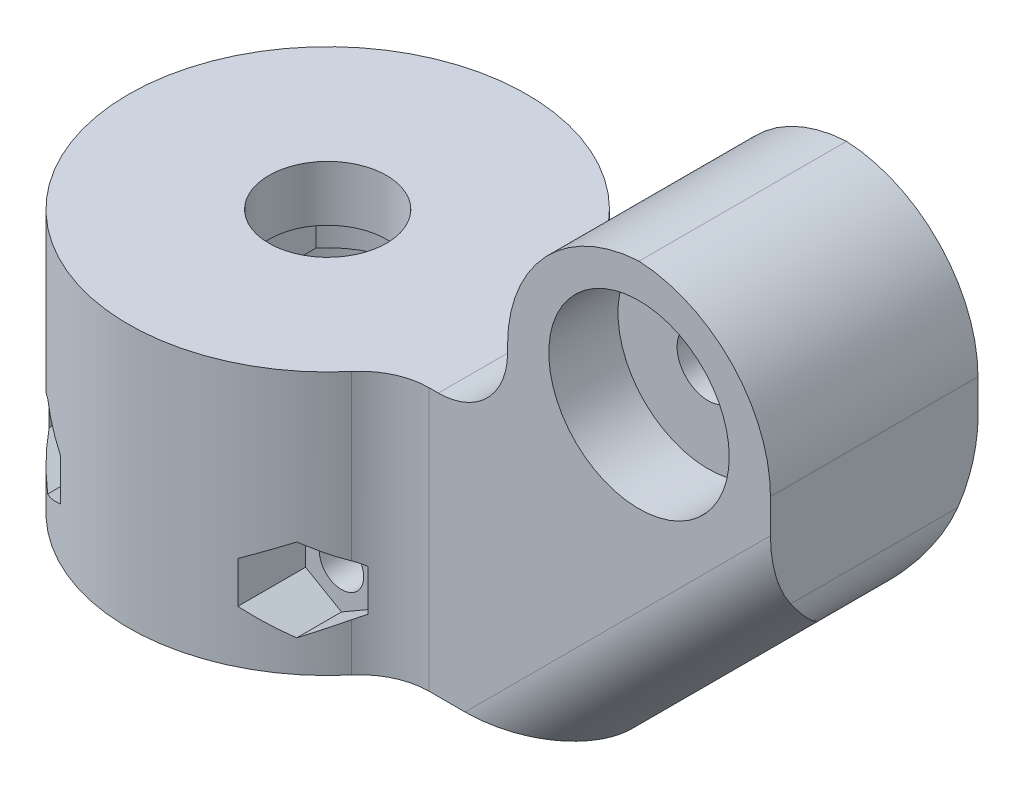
from build123d import *

# Parameters (mm, degrees)
SKETCH1_R               = 2.25
BOSS_EXTRUDE1_DEPTH     = 7.5
CUT_EXTRUDE1_START      = 7.5
SKETCH1_3_R             = 6.52
CUT_EXTRUDE1_DEPTH      = 5
CUT_EXTRUDE2_START      = -7.5
SKETCH1_4_R             = 6.52
CUT_EXTRUDE2_DEPTH      = 5
SKETCH2_R               = 14.4
BOSS_EXTRUDE2_DEPTH     = 19
CUT_EXTRUDE3_DEPTH      = 51.395634732
CUT_EXTRUDE3_DEPTH_BACK = 51.395634732
FILLET1_R               = 5
FILLET2_R               = 10
CUT_EXTRUDE6_DEPTH      = 15
SKETCH5_R               = 8.1
CUT_EXTRUDE7_DEPTH      = 12
CUT_EXTRUDE8_DEPTH      = 54.197654084
CUT_EXTRUDE8_DEPTH_BACK = 54.197654084
SKETCH6_R               = 1.6
CUT_EXTRUDE9_START      = 20
SKETCH6_3_R             = 1.6
CUT_EXTRUDE9_DEPTH      = 12
CUT_EXTRUDE10_START     = -9
SKETCH6_4_R             = 3.5
CUT_EXTRUDE10_DEPTH     = 12
FILLET3_R               = 5


with BuildPart() as part:
    # Sketch1 → Boss-Extrude1 (new, symmetric)
    with BuildSketch(Plane.XY):
        Polygon((-9.5, 9), (9.5, 9), (9.5, -10.52), (-5.5, -25.52), (-30, -25.52), (-30, -6.52), (-9.5, -6.52), align=None)
        Circle(SKETCH1_R, mode=Mode.SUBTRACT)
    extrude(amount=BOSS_EXTRUDE1_DEPTH, both=True)

    # Sketch1<3> → Cut-Extrude1 (cut)
    with BuildSketch(Plane.XY.offset(CUT_EXTRUDE1_START)):
        Circle(SKETCH1_3_R)
    extrude(amount=-CUT_EXTRUDE1_DEPTH, mode=Mode.SUBTRACT)

    # Sketch1<4> → Cut-Extrude2 (cut)
    with BuildSketch(Plane.XY.offset(CUT_EXTRUDE2_START)):
        Circle(SKETCH1_4_R)
    extrude(amount=CUT_EXTRUDE2_DEPTH, mode=Mode.SUBTRACT)

    # Sketch2 → Boss-Extrude2 (add, through all)
    with BuildSketch(Plane(origin=(0, -6.52, 0), x_dir=(1, 0, 0), z_dir=(0, 1, 0))):
        with Locations((-30, 0)):
            Circle(SKETCH2_R)
    extrude(amount=-BOSS_EXTRUDE2_DEPTH)

    # Sketch2<3> → Cut-Extrude3 (cut, two sides: drawn at the far end of the back side and taken through both)
    with BuildSketch(Plane(origin=(0, -6.52, 0), x_dir=(1, 0, 0), z_dir=(0, 1, 0)).offset(-CUT_EXTRUDE3_DEPTH_BACK)):
        with BuildLine():
            ThreePointArc((-30, -4.25), (-26.99479618, -3.00520382), (-25.75, 0))
            ThreePointArc((-25.75, 0), (-26.99479618, 3.00520382), (-30, 4.25))
            Line((-30, 4.25), (-30, -4.25))
        make_face()
        with BuildLine():
            Line((-30, -4.25), (-30, 4.25))
            ThreePointArc((-30, 4.25), (-34.25, 0), (-30, -4.25))
        make_face()
    extrude(amount=CUT_EXTRUDE3_DEPTH + CUT_EXTRUDE3_DEPTH_BACK, mode=Mode.SUBTRACT)

    # Fillet1
    fillet1_edges = [part.edges().sort_by_distance(p)[0] for p in [
        (-9.5, -6.52, 0),
        (-17.707319251, -16.02, -7.5),
        (-17.707319251, -16.02, 7.5),
    ]]
    fillet(fillet1_edges, radius=FILLET1_R)

    # Fillet2
    # the kernel refuses this fillet: 10 mm, written as the material it takes off along each edge
    with BuildSketch(Plane(origin=(-9.5, 9, -32.5), x_dir=(0, -1, 0), z_dir=(0, 0, 1))) as fillet2_piece_1:
        with BuildLine():
            CenterArc((FILLET2_R, FILLET2_R), FILLET2_R, 180, 90)
            Line((0, FILLET2_R), (0, 0))
            Line((0, 0), (FILLET2_R, 0))
        make_face()
    extrude(amount=65, mode=Mode.SUBTRACT)
    with BuildSketch(Plane(origin=(9.5, 9, 32.5), x_dir=(-1, 0, 0), z_dir=(0, 0, -1))) as fillet2_piece_2:
        with BuildLine():
            CenterArc((FILLET2_R, -FILLET2_R), FILLET2_R, 90, 90)
            Line((0, -FILLET2_R), (0, 0))
            Line((0, 0), (FILLET2_R, 0))
        make_face()
    extrude(amount=65, mode=Mode.SUBTRACT)

    # Sketch4 → Cut-Extrude6 (cut)
    with BuildSketch(Plane.XZ.offset(25.52)):
        with BuildLine():
            Line((-25, -4.153311931), (-25, 4.153311931))
            ThreePointArc((-25, 4.153311931), (-30, 6.5), (-35, 4.153311931))
            Line((-35, 4.153311931), (-35, -4.153311931))
            ThreePointArc((-35, -4.153311931), (-30, -6.5), (-25, -4.153311931))
        make_face()
    extrude(amount=-CUT_EXTRUDE6_DEPTH, mode=Mode.SUBTRACT)

    # Sketch5 → Cut-Extrude7 (cut)
    with BuildSketch(Plane.XZ.offset(25.52)):
        with Locations((-30, 0)):
            Circle(SKETCH5_R)
    extrude(amount=-CUT_EXTRUDE7_DEPTH, mode=Mode.SUBTRACT)

    # Sketch6 → Cut-Extrude8 (cut, two sides: drawn at the far end of the back side and taken through both)
    with BuildSketch(Plane.XY.offset(-CUT_EXTRUDE8_DEPTH_BACK)):
        with Locations((-39, -20.22)):
            Circle(SKETCH6_R)
        with Locations((-21, -20.22)):
            Circle(SKETCH6_R)
    extrude(amount=CUT_EXTRUDE8_DEPTH + CUT_EXTRUDE8_DEPTH_BACK, mode=Mode.SUBTRACT)

    # Sketch6<3> → Cut-Extrude9 (cut)
    # profile 1 of 2: a face of its own
    with BuildSketch(Plane.XY.offset(CUT_EXTRUDE9_START)):
        Polygon((-36.401923789, -21.72), (-36.401923789, -18.72), (-39, -17.22), (-41.598076211, -18.72), (-41.598076211, -21.72), (-39, -23.22), align=None)
        with Locations((-39, -20.22)):
            Circle(SKETCH6_3_R, mode=Mode.SUBTRACT)
    # profile 2 of 2: a face of its own
    with BuildSketch(Plane.XY.offset(CUT_EXTRUDE9_START)):
        Polygon((-23.598076211, -18.72), (-21, -17.22), (-18.401923789, -18.72), (-18.401923789, -21.72), (-21, -23.22), (-23.598076211, -21.72), align=None)
        with Locations((-21, -20.22)):
            Circle(SKETCH6_3_R, mode=Mode.SUBTRACT)
    extrude(amount=-CUT_EXTRUDE9_DEPTH, mode=Mode.SUBTRACT)

    # Sketch6<4> → Cut-Extrude10 (cut)
    with BuildSketch(Plane.XY.offset(CUT_EXTRUDE10_START)):
        with Locations((-39, -20.22)):
            Circle(SKETCH6_4_R)
        with Locations((-21, -20.22)):
            Circle(SKETCH6_4_R)
    extrude(amount=-CUT_EXTRUDE10_DEPTH, mode=Mode.SUBTRACT)

    # Fillet3
    fillet3_edges = [part.edges().sort_by_distance(p)[0] for p in [
        (2, -18.02, -7.5),
        (9.5, -10.52, 0),
        (2, -18.02, 7.5),
    ]]
    fillet(fillet3_edges, radius=FILLET3_R)


solid = part.part
